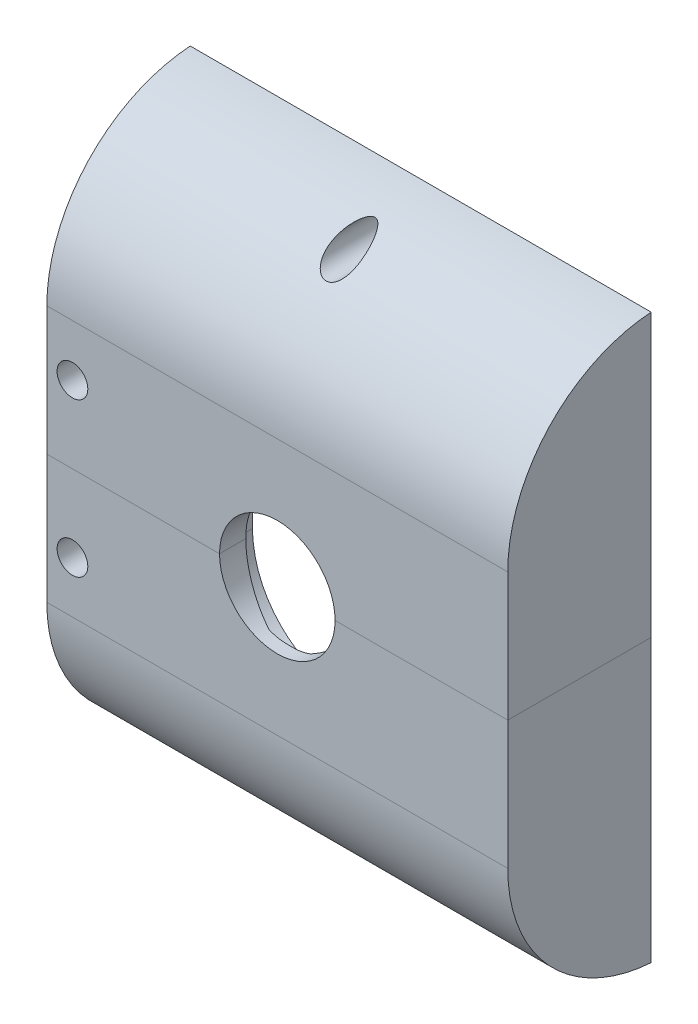
from build123d import *

# Parameters (mm, degrees)
SKETCH1_W           = 90
SKETCH1_H           = 110
BOSS_EXTRUDE1_DEPTH = 28
FILLET2_R           = 30
SKETCH3_R           = 1.5
CUT_EXTRUDE1_DEPTH  = 145.858551698
SKETCH4_R           = 3
CUT_EXTRUDE4_DEPTH  = 26
CUT_EXTRUDE5_START  = -13.7
SKETCH5_W           = 73
SKETCH5_H           = 87
CUT_EXTRUDE5_DEPTH  = 13.7
CUT_EXTRUDE5_TAPER  = 15
SKETCH8_W           = 73
SKETCH8_H           = 87
CUT_EXTRUDE8_DEPTH  = 11.8
CUT_EXTRUDE8_DRAFT  = -70
CUT_EXTRUDE9_START  = 30
SKETCH9_R           = 11.28
CUT_EXTRUDE9_DEPTH  = 61.8
FILLET19_R          = 20
CUT_EXTRUDE10_START = 54.999995
CUT_EXTRUDE10_DEPTH = 0.0001
CUT_EXTRUDE12_REACH = 146.859


# Read off the part's stored shape, not the designer's step: Cut-Extrude10
with BuildPart() as part:
    # Sketch1 → Boss-Extrude1 (new body)
    with BuildSketch(Plane.XY):
        with Locations((45, 55)):
            Rectangle(SKETCH1_W, SKETCH1_H)
    extrude(amount=BOSS_EXTRUDE1_DEPTH)

    # Fillet2
    # the kernel refuses this fillet: 30 mm, written as the material it takes off along each edge
    with BuildSketch(Plane(origin=(-74.833147735, 0, 28), x_dir=(0, 0, -1), z_dir=(1, 0, 0)), Plane(origin=(164.833147735, 110, 28), x_dir=(0, 0, -1), z_dir=(-1, 0, 0))) as fillet2_piece_1:
        with BuildLine():
            CenterArc((30, 29.933259094), FILLET2_R, 180, 86.177446271)
            Line((0, 29.933259094), (-0.6, 29.933259094))
            Line((-0.6, 29.933259094), (-0.6, 0))
            Line((-0.6, 0), (0, -0.6))
            ThreePointArc((0, -0.6), (14, -0.6), (27.96, -0.598665182))
            Line((27.96, -0.598665182), (28, 0))
        make_face()
    extrude(amount=239.666295471, mode=Mode.SUBTRACT)

    # Sketch3 → Cut-Extrude1 (cut, through all)
    with BuildSketch(Plane(origin=(0, 0, 0), x_dir=(-1, 0, 0), z_dir=(0, 0, -1))):
        with Locations((-45, 105)):
            Circle(SKETCH3_R)
        with Locations((-45, 5)):
            Circle(SKETCH3_R)
        with Locations((-5, 70)):
            Circle(SKETCH3_R)
        with Locations((-5, 40)):
            Circle(SKETCH3_R)
    extrude(amount=-CUT_EXTRUDE1_DEPTH, mode=Mode.SUBTRACT)

    # Sketch4 → Cut-Extrude4 (cut)
    with BuildSketch(Plane.XY.offset(28)):
        with Locations((45, 105)):
            Circle(SKETCH4_R)
        with Locations((45, 5)):
            Circle(SKETCH4_R)
        with Locations((5, 70)):
            Circle(SKETCH4_R)
        with Locations((5, 40)):
            Circle(SKETCH4_R)
    extrude(amount=-CUT_EXTRUDE4_DEPTH, mode=Mode.SUBTRACT)

    # Sketch5 → Cut-Extrude5 (cut)
    with BuildSketch(Plane(origin=(0, 0, 0), x_dir=(-1, 0, 0), z_dir=(0, 0, -1)).offset(CUT_EXTRUDE5_START)):
        with Locations((-45, 55)):
            Rectangle(SKETCH5_W, SKETCH5_H)
    extrude(amount=CUT_EXTRUDE5_DEPTH, taper=CUT_EXTRUDE5_TAPER, mode=Mode.SUBTRACT)


with BuildPart() as cut_extrude8_tool:
    # Sketch8 → Cut-Extrude8 (with draft: the straight prism first)
    with BuildSketch(Plane(origin=(0, 0, 13.7), x_dir=(-1, 0, 0), z_dir=(0, 0, -1))):
        with Locations((-45, 55)):
            Rectangle(SKETCH8_W, SKETCH8_H)
    extrude(amount=-CUT_EXTRUDE8_DEPTH)
    # Cut-Extrude8: the draft: its side faces are tilted about the plane it starts from
    cut_extrude8_sides = [cut_extrude8_tool.faces().sort_by_distance(p)[0] for p in [
        (81.5, 55, 19.6),
        (45, 11.5, 19.6),
        (8.5, 55, 19.6),
        (45, 98.5, 19.6),
    ]]
    draft(cut_extrude8_sides, Plane(origin=(0, 0, 13.7), x_dir=(-1, 0, 0), z_dir=(0, 0, -1)), CUT_EXTRUDE8_DRAFT)


with BuildPart() as part_1:
    add(part.part)

    # Cut-Extrude8: cut by cut_extrude8_tool
    add(cut_extrude8_tool.part, mode=Mode.SUBTRACT)

    # Sketch9 → Cut-Extrude9 (cut)
    with BuildSketch(Plane(origin=(0, 0, 25.5), x_dir=(-1, 0, 0), z_dir=(0, 0, -1)).offset(CUT_EXTRUDE9_START)):
        with Locations((-45.00023355, 55.00023355)):
            Circle(SKETCH9_R)
    extrude(amount=-CUT_EXTRUDE9_DEPTH, mode=Mode.SUBTRACT)

    # Fillet19
    fillet19_edges = [part_1.edges().sort_by_distance(p)[0] for p in [
        (79.664548032, 96.664548032, 6.85),
        (79.664548032, 13.335451968, 6.85),
        (10.335451968, 13.335451968, 6.85),
        (10.335451968, 96.664548032, 6.85),
    ]]
    fillet(fillet19_edges, radius=FILLET19_R)

    # Cut-Extrude10 outline → Cut-Extrude10 (cut)
    with BuildSketch(Plane(origin=(0, 0, 0), x_dir=(1, 0, 0), z_dir=(0, 1, 0)).offset(CUT_EXTRUDE10_START)):
        Polygon((90, -28), (90, 0), (77.829096064, 0), (12.170903936, 0), (0, 0), (0, -28), align=None)
    extrude(amount=CUT_EXTRUDE10_DEPTH, mode=Mode.SUBTRACT)

    # Cut-Extrude12: up to this plane
    cut_extrude12_end = Plane(origin=(8.5, 11.5, 13.7), z_dir=(-0.9659258262890681, 0, -0.25881904510252135))
    # Sketch14 → Cut-Extrude12 (cut, up to the surface)
    with BuildSketch(Plane.ZY, mode=Mode.PRIVATE) as cut_extrude12_sk1:
        with BuildLine():
            Line((6.5, 58.5), (0, 58.5))
            Line((0, 58.5), (0, 51.5))
            Line((0, 51.5), (6.5, 51.5))
            ThreePointArc((6.5, 51.5), (10, 55), (6.5, 58.5))
        make_face()
    cut_extrude12_tool1 = split(extrude(cut_extrude12_sk1.sketch, amount=-CUT_EXTRUDE12_REACH, mode=Mode.PRIVATE), bisect_by=cut_extrude12_end, keep=Keep.BOTH, mode=Mode.PRIVATE)
    add(cut_extrude12_tool1.solids().sort_by_distance((0, 55, 4.657437))[0], mode=Mode.SUBTRACT)


solid = part_1.part
